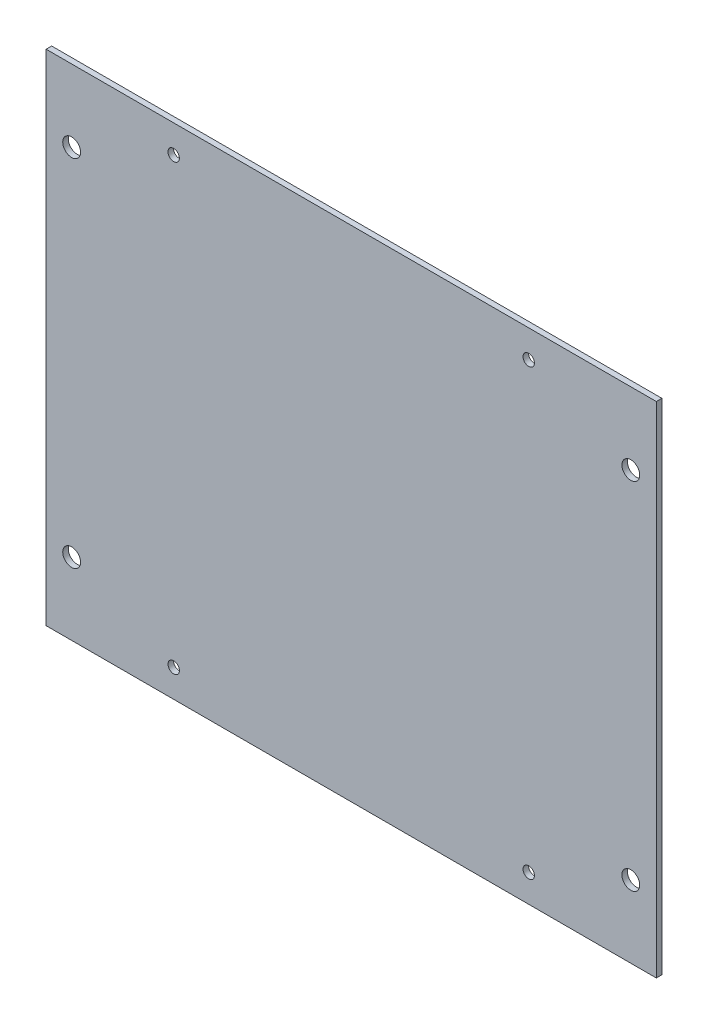
from build123d import *

# Parameters (mm, degrees)
SKETCH3_W              = 914.4
SKETCH3_H              = 609.6
BOSS_EXTRUDE1_DEPTH    = 0.79375
SKETCH4_OUTSIDE_W      = 1136.194
SKETCH4_OUTSIDE_H      = 831.394
SKETCH4_OUTSIDE_W_2    = 174.625
SKETCH4_OUTSIDE_H_2    = 142.875
CUT_EXTRUDE1_DEPTH     = 2.54
F_4_CLEARANCE_HOLE1_D  = 3.2639
F_10_CLEARANCE_HOLE1_D = 5.1054


with BuildPart() as part:
    # Sketch3 → Boss-Extrude1 (new, symmetric)
    with BuildSketch(Plane.XY):
        Rectangle(SKETCH3_W, SKETCH3_H)
    extrude(amount=BOSS_EXTRUDE1_DEPTH, both=True)

    # Sketch4 outside → Cut-Extrude1 (cut)
    with BuildSketch(Plane(origin=(0, 0, -0.79375), x_dir=(-1, 0, 0), z_dir=(0, 0, -1))):
        Rectangle(SKETCH4_OUTSIDE_W, SKETCH4_OUTSIDE_H)
        with Locations((306.247206985, -11.515137804)):
            Rectangle(SKETCH4_OUTSIDE_W_2, SKETCH4_OUTSIDE_H_2, mode=Mode.SUBTRACT)
    extrude(amount=-CUT_EXTRUDE1_DEPTH, mode=Mode.SUBTRACT)

    # #4 Clearance Hole1 (through all)
    with Locations(Plane(origin=(0, 0, -0.79375), x_dir=(-1, 0, 0), z_dir=(0, 0, -1))):
        with Locations((255.447206985, -75.015137804), (357.065534985, 51.959462196), (357.047206985, -75.015137804), (255.447206985, 51.984862196)):
            Hole(F_4_CLEARANCE_HOLE1_D / 2)

    # #10 Clearance Hole1 (through all)
    with Locations(Plane(origin=(0, 0, -0.79375), x_dir=(-1, 0, 0), z_dir=(0, 0, -1))):
        with Locations((226.237206985, -62.315137296), (226.237206985, 39.284562202), (386.257206985, 39.284861688), (386.257206985, -62.31483781)):
            Hole(F_10_CLEARANCE_HOLE1_D / 2)


solid = part.part
